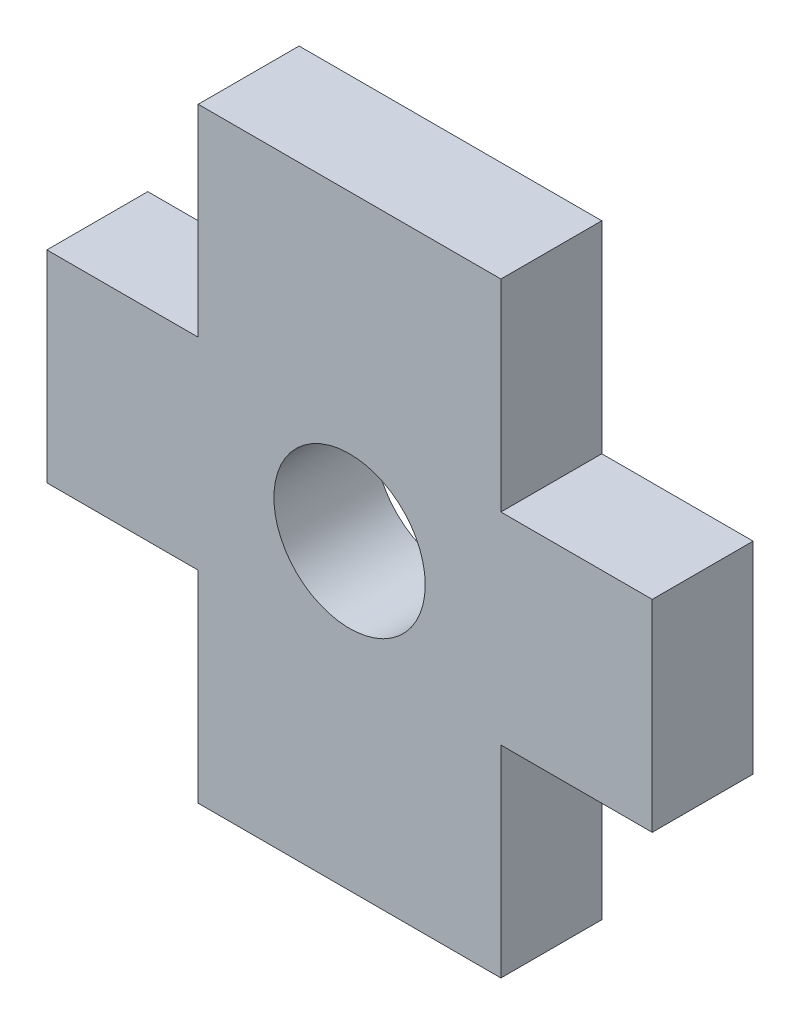
from build123d import *

# Parameters (mm, degrees)
SKETCH1_R           = 1.5
BOSS_EXTRUDE1_DEPTH = 2


with BuildPart() as part:
    # Sketch1 → Boss-Extrude1 (new body)
    with BuildSketch(Plane.XY):
        Polygon((-3, -6), (3, -6), (3, -2), (6, -2), (6, 2), (3, 2), (3, 6), (-3, 6), (-3, 2), (-6, 2), (-6, -2), (-3, -2), align=None)
        Circle(SKETCH1_R, mode=Mode.SUBTRACT)
    extrude(amount=BOSS_EXTRUDE1_DEPTH)


solid = part.part
